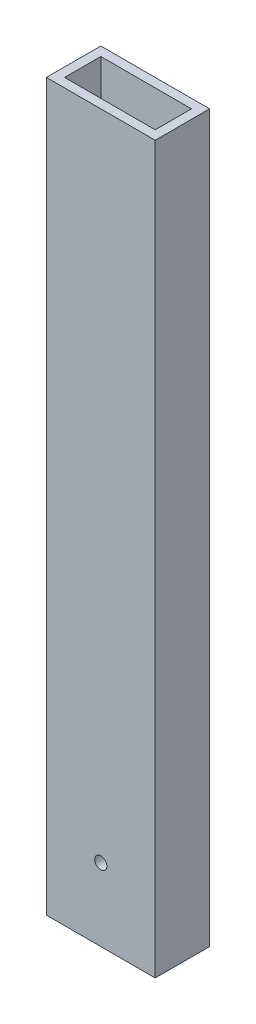
from build123d import *

# Parameters (mm, degrees)
SKETCH1_W           = 38.1
SKETCH1_H           = 19.05
SKETCH1_W_2         = 31.75
SKETCH1_H_2         = 12.7
BOSS_EXTRUDE1_DEPTH = 254
SKETCH2_R           = 2.125
CUT_EXTRUDE1_DEPTH  = 258.547107342


with BuildPart() as part:
    # Sketch1 → Boss-Extrude1 (new body)
    with BuildSketch(Plane(origin=(0, 0, 0), x_dir=(1, 0, 0), z_dir=(0, 1, 0))):
        with Locations((19.05, 9.525)):
            Rectangle(SKETCH1_W, SKETCH1_H)
        with Locations((19.05, 9.525)):
            Rectangle(SKETCH1_W_2, SKETCH1_H_2, mode=Mode.SUBTRACT)
    extrude(amount=BOSS_EXTRUDE1_DEPTH)

    # Sketch2 → Cut-Extrude1 (cut, through all)
    with BuildSketch(Plane(origin=(0, 0, -19.05), x_dir=(-1, 0, 0), z_dir=(0, 0, -1))):
        with Locations((-19.05, 25.4)):
            Circle(SKETCH2_R)
    extrude(amount=-CUT_EXTRUDE1_DEPTH, mode=Mode.SUBTRACT)


solid = part.part
